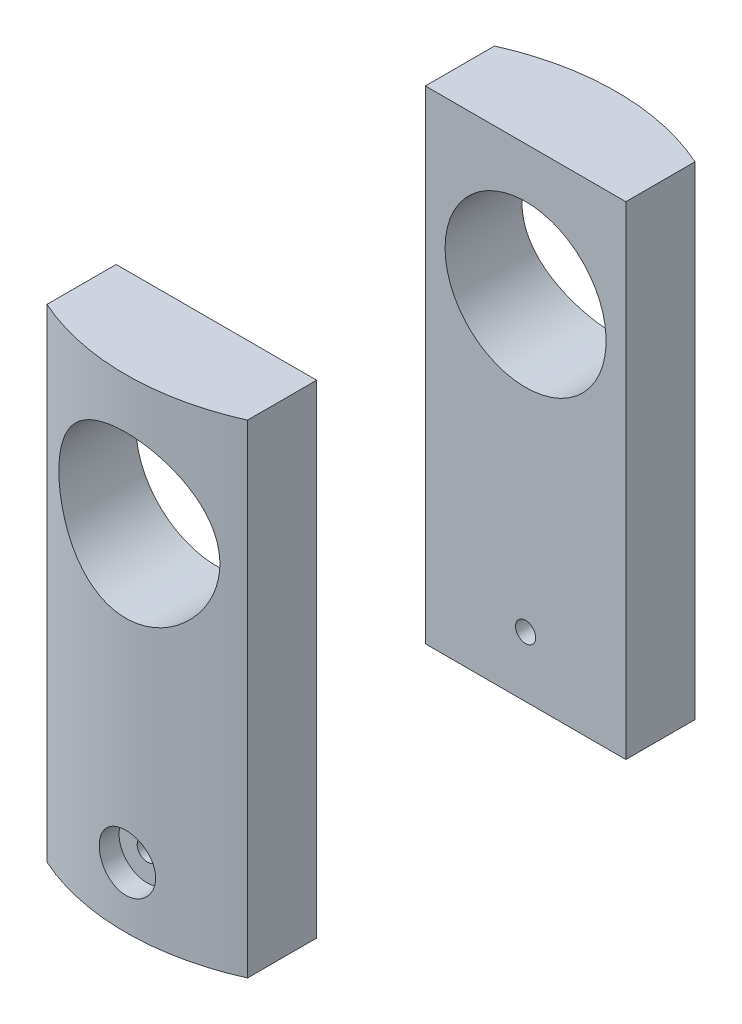
from build123d import *

# Parameters (mm, degrees)
BOSS_EXTRUDE1_DEPTH     = 152.4
BOSS_EXTRUDE1_2_DEPTH   = 152.4
CUT_EXTRUDE1_DEPTH      = 127
CUT_EXTRUDE1_DEPTH_BACK = 30.48
SKETCH4_R               = 3.175
CUT_EXTRUDE2_DEPTH      = 127
CUT_EXTRUDE2_DEPTH_BACK = 30.48
SKETCH5_R               = 25.4
SKETCH6_R               = 8.89
CUT_EXTRUDE3_DEPTH      = 10.16
CUT_EXTRUDE4_START      = 10.16
SKETCH7_R               = 8.89
CUT_EXTRUDE4_DEPTH      = 10.16


with BuildPart() as part:
    # Sketch3 → Boss-Extrude1 (new body)
    with BuildSketch(Plane(origin=(0, 0, 0), x_dir=(1, 0, 0), z_dir=(0, 1, 0))):
        with BuildLine():
            Line((-31.623, 48.768), (31.623, 48.768))
            Line((31.623, 48.768), (31.623, 70.582756534))
            ThreePointArc((31.623, 70.582756534), (0, 77.343), (-31.623, 70.582756534))
            Line((-31.623, 70.582756534), (-31.623, 48.768))
        make_face()
    extrude(amount=BOSS_EXTRUDE1_DEPTH)


with BuildPart() as body_2:
    # Sketch3 → Boss-Extrude1 2 (new body)
    with BuildSketch(Plane(origin=(0, 0, 0), x_dir=(1, 0, 0), z_dir=(0, 1, 0))):
        with BuildLine():
            Line((-31.623, -48.768), (31.623, -48.768))
            Line((31.623, -48.768), (31.623, -70.582756534))
            ThreePointArc((31.623, -70.582756534), (0, -77.343), (-31.623, -70.582756534))
            Line((-31.623, -70.582756534), (-31.623, -48.768))
        make_face()
    extrude(amount=BOSS_EXTRUDE1_2_DEPTH)


with BuildPart() as cut_extrude1_tool:
    # Sketch4 → Cut-Extrude1 (new, two sides: drawn at the far end of the back side and taken through both)
    with BuildSketch(Plane.XY.offset(-48.768).offset(-CUT_EXTRUDE1_DEPTH_BACK)):
        with Locations((0, 19.05)):
            Circle(SKETCH4_R)
    extrude(amount=CUT_EXTRUDE1_DEPTH + CUT_EXTRUDE1_DEPTH_BACK)


with BuildPart() as part_1:
    add(part.part)

    # Cut-Extrude1: cut by cut_extrude1_tool
    add(cut_extrude1_tool.part, mode=Mode.SUBTRACT)


with BuildPart() as body_2_1:
    add(body_2.part)

    # Cut-Extrude1: cut by cut_extrude1_tool
    add(cut_extrude1_tool.part, mode=Mode.SUBTRACT)


with BuildPart() as cut_extrude2_tool:
    # Sketch5 → Cut-Extrude2 (new, two sides: drawn at the far end of the back side and taken through both)
    with BuildSketch(Plane.XY.offset(-48.768).offset(-CUT_EXTRUDE2_DEPTH_BACK)):
        with Locations((0, 111.241035357)):
            Circle(SKETCH5_R)
    extrude(amount=CUT_EXTRUDE2_DEPTH + CUT_EXTRUDE2_DEPTH_BACK)


with BuildPart() as part_2:
    add(part_1.part)

    # Cut-Extrude2: cut by cut_extrude2_tool
    add(cut_extrude2_tool.part, mode=Mode.SUBTRACT)

    # Sketch6 → Cut-Extrude3 (cut)
    with BuildSketch(Plane(origin=(0, 0, -70.582756534), x_dir=(-1, 0, 0), z_dir=(0, 0, -1))):
        with Locations((0, 19.05)):
            Circle(SKETCH6_R)
    extrude(amount=CUT_EXTRUDE3_DEPTH, mode=Mode.SUBTRACT)


with BuildPart() as body_2_2:
    add(body_2_1.part)

    # Cut-Extrude2: cut by cut_extrude2_tool
    add(cut_extrude2_tool.part, mode=Mode.SUBTRACT)

    # Sketch7 → Cut-Extrude4 (cut)
    with BuildSketch(Plane.XY.offset(70.582756534).offset(CUT_EXTRUDE4_START)):
        with Locations((0, 19.05)):
            Circle(SKETCH7_R)
    extrude(amount=-CUT_EXTRUDE4_DEPTH, mode=Mode.SUBTRACT)


solid = Compound([part_2.part, body_2_2.part])
